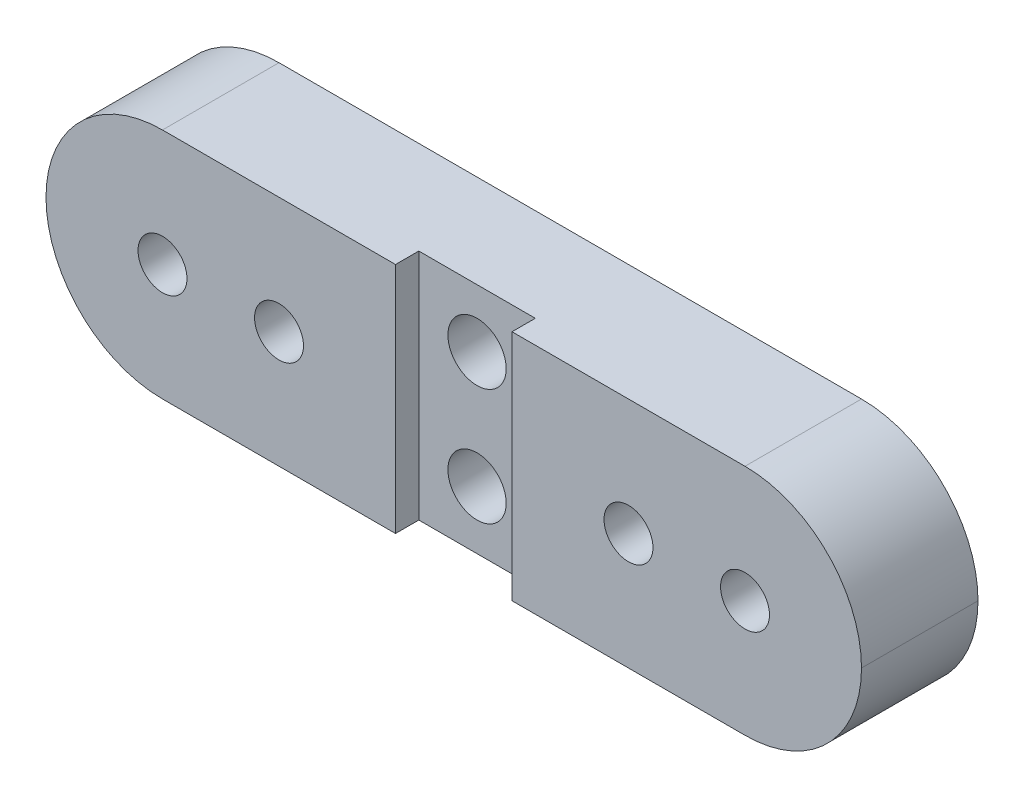
from build123d import *

# Parameters (mm, degrees)
ESQUISSE1_R             = 2.5
BOSS_EXTRU_1_DEPTH      = 10
CONG_1_R                = 10
TROU_TARAUD_M5X0_81_D   = 4.2
ESQUISSE5_W             = 10
ESQUISSE5_H             = 20
ENL_V_MAT_EXTRU_1_DEPTH = 2


with BuildPart() as part:
    # Esquisse1 → Boss.-Extru.1 (new body)
    with BuildSketch(Plane.XY):
        Polygon((50, 20), (0, 20), (0, 0), (50, 0), (60, 0), (70, 0), (70, 20), (60, 20), align=None)
        with Locations((35, 5)):
            Circle(ESQUISSE1_R, mode=Mode.SUBTRACT)
        with Locations((35, 15)):
            Circle(ESQUISSE1_R, mode=Mode.SUBTRACT)
    extrude(amount=BOSS_EXTRU_1_DEPTH)

    # Congé1
    cong_1_edges = [part.edges().sort_by_distance(p)[0] for p in [
        (0, 0, 5),
        (0, 20, 5),
        (70, 0, 5),
        (70, 20, 5),
    ]]
    fillet(cong_1_edges, radius=CONG_1_R - 0.0001)  # a hair under: the kernel refuses the full size

    # Trou taraudé M5x0.81 (through all)
    with Locations(Plane.XY.offset(10)):
        with Locations((50, 10), (60, 10), (10, 10), (20, 10)):
            Hole(TROU_TARAUD_M5X0_81_D / 2)

    # Esquisse5 → Enlèv. mat.-Extru.1 (cut)
    with BuildSketch(Plane.XY.offset(10)):
        with Locations((35, 10)):
            Rectangle(ESQUISSE5_W, ESQUISSE5_H)
    extrude(amount=-ENL_V_MAT_EXTRU_1_DEPTH, mode=Mode.SUBTRACT)


solid = part.part
